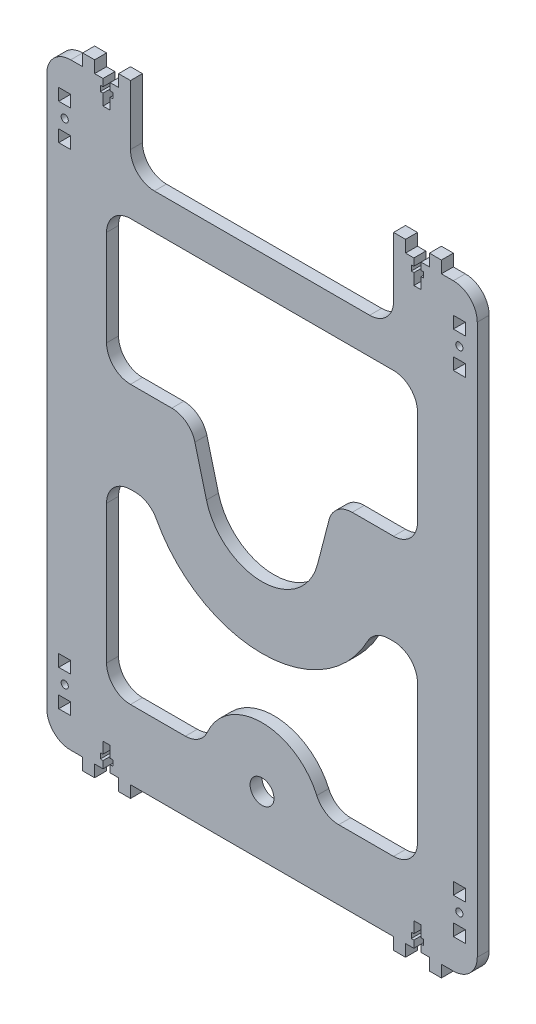
from build123d import *

# Parameters (mm, degrees)
SKETCH1_W           = 5
SKETCH1_H           = 5
SKETCH1_R           = 1.5
SKETCH1_R_2         = 5
BOSS_EXTRUDE1_DEPTH = 5
FILLET1_R           = 10


with BuildPart() as part:
    # Sketch1 → Boss-Extrude1 (new body)
    with BuildSketch(Plane.XY):
        Polygon((-75, 125), (-90, 125), (-90, -125), (-75, -125), (-75, -130), (-70, -130), (-70, -125), (-66.5, -125), (-66.5, -122), (-67.6, -122), (-67.6, -119.7), (-66.5, -119.7), (-66.5, -115), (-63.5, -115), (-63.5, -119.7), (-62.4, -119.7), (-62.4, -122), (-63.5, -122), (-63.5, -125), (-60, -125), (-60, -130), (-55, -130), (-55, -125), (55, -125), (55, -130), (60, -130), (60, -125), (63.5, -125), (63.5, -122), (62.4, -122), (62.4, -119.7), (63.5, -119.7), (63.5, -115), (66.5, -115), (66.5, -119.7), (67.6, -119.7), (67.6, -122), (66.5, -122), (66.5, -125), (70, -125), (70, -130), (75, -130), (75, -125), (90, -125), (90, 125), (75, 125), (75, 130), (70, 130), (70, 125), (66.5, 125), (66.5, 122), (67.6, 122), (67.6, 119.7), (66.5, 119.7), (66.5, 115), (63.5, 115), (63.5, 119.7), (62.4, 119.7), (62.4, 122), (63.5, 122), (63.5, 125), (60, 125), (60, 130), (55, 130), (55, 95), (-55, 95), (-55, 130), (-60, 130), (-60, 125), (-63.5, 125), (-63.5, 122), (-62.4, 122), (-62.4, 119.7), (-63.5, 119.7), (-63.5, 115), (-66.5, 115), (-66.5, 119.7), (-67.6, 119.7), (-67.6, 122), (-66.5, 122), (-66.5, 125), (-70, 125), (-70, 130), (-75, 130), align=None)
        with Locations((-82.5, -110)):
            Rectangle(SKETCH1_W, SKETCH1_H, mode=Mode.SUBTRACT)
        with Locations((-82.5, -102.5)):
            Circle(SKETCH1_R, mode=Mode.SUBTRACT)
        with Locations((-82.5, -95)):
            Rectangle(SKETCH1_W, SKETCH1_H, mode=Mode.SUBTRACT)
        with Locations((0, -100)):
            Circle(SKETCH1_R_2, mode=Mode.SUBTRACT)
        with Locations((82.5, -110)):
            Rectangle(SKETCH1_W, SKETCH1_H, mode=Mode.SUBTRACT)
        with Locations((82.5, -102.5)):
            Circle(SKETCH1_R, mode=Mode.SUBTRACT)
        with Locations((82.5, -95)):
            Rectangle(SKETCH1_W, SKETCH1_H, mode=Mode.SUBTRACT)
        with BuildLine():
            Line((-65, -18.081635275), (-46.616032283, -18.081635275))
            ThreePointArc((-46.616032283, -18.081635275), (0, -50), (46.616032283, -18.081635275))
            Line((46.616032283, -18.081635275), (65, -18.081635275))
            Line((65, -18.081635275), (65, -95.958016924))
            Line((65, -95.958016924), (24.671083738, -95.958016924))
            ThreePointArc((24.671083738, -95.958016924), (0, -75), (-24.671083738, -95.958016924))
            Line((-24.671083738, -95.958016924), (-65, -95.958016924))
            Line((-65, -95.958016924), (-65, -18.081635275))
        make_face(mode=Mode.SUBTRACT)
        with Locations((-82.5, 95)):
            Rectangle(SKETCH1_W, SKETCH1_H, mode=Mode.SUBTRACT)
        with Locations((-82.5, 102.5)):
            Circle(SKETCH1_R, mode=Mode.SUBTRACT)
        with Locations((-82.5, 110)):
            Rectangle(SKETCH1_W, SKETCH1_H, mode=Mode.SUBTRACT)
        with BuildLine():
            ThreePointArc((23.227291604, -6.040937406), (0, -24), (-23.227291604, -6.040937406))
            Line((-23.227291604, -6.040937406), (-30, 20))
            Line((-30, 20), (-65, 20))
            Line((-65, 20), (-65, 80))
            Line((-65, 80), (65, 80))
            Line((65, 80), (65, 20))
            Line((65, 20), (30, 20))
            Line((30, 20), (23.227291604, -6.040937406))
        make_face(mode=Mode.SUBTRACT)
        with Locations((82.5, 95)):
            Rectangle(SKETCH1_W, SKETCH1_H, mode=Mode.SUBTRACT)
        with Locations((82.5, 102.5)):
            Circle(SKETCH1_R, mode=Mode.SUBTRACT)
        with Locations((82.5, 110)):
            Rectangle(SKETCH1_W, SKETCH1_H, mode=Mode.SUBTRACT)
    extrude(amount=BOSS_EXTRUDE1_DEPTH)

    # Fillet1
    fillet1_edges = [part.edges().sort_by_distance(p)[0] for p in [
        (-90, -125, 2.5),
        (90, -125, 2.5),
        (-90, 125, 2.5),
        (90, 125, 2.5),
        (-55, 95, 2.5),
        (55, 95, 2.5),
        (24.671083738, -95.958016924, 2.5),
        (-24.671083738, -95.958016924, 2.5),
        (-65, -95.958016924, 2.5),
        (65, -95.958016924, 2.5),
        (65, -18.081635275, 2.5),
        (46.616032283, -18.081635275, 2.5),
        (-46.616032283, -18.081635275, 2.5),
        (-65, -18.081635275, 2.5),
        (65, 80, 2.5),
        (-65, 80, 2.5),
        (65, 20, 2.5),
        (-65, 20, 2.5),
        (30, 20, 2.5),
        (-30, 20, 2.5),
    ]]
    fillet(fillet1_edges, radius=FILLET1_R)


solid = part.part
